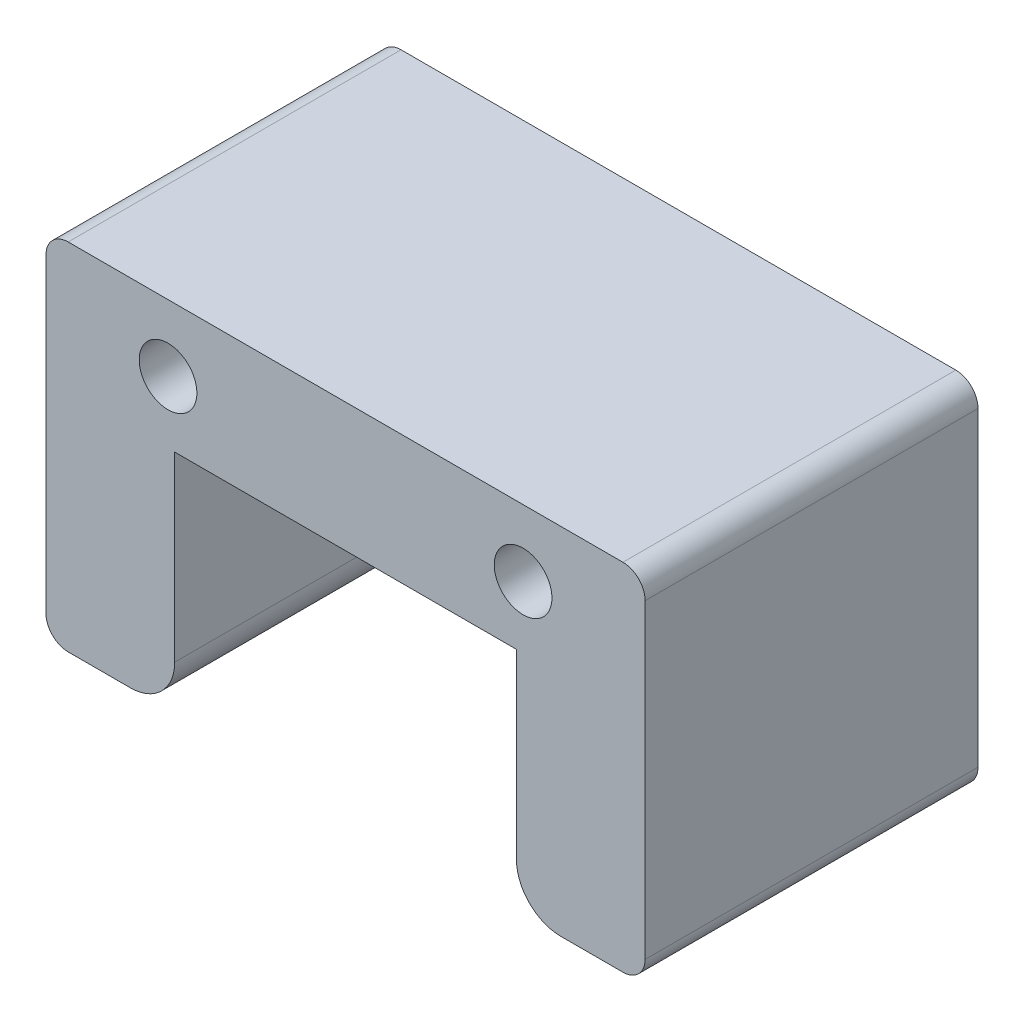
from build123d import *

# Parameters (mm, degrees)
SKETCH_1_R               = 1.3
EXTRUDE_1_DEPTH          = 15
FILLET_1_R               = 1
CUT_EXTRUDE_2_DEPTH      = 23.983689869
CUT_EXTRUDE_2_DEPTH_BACK = 23.983689869
FILLET_2_R               = 2
SKETCH_5_R               = 3.15
CUT_EXTRUDE_3_DEPTH      = 2.8


with BuildPart() as part:
    # ｽｹｯﾁ1 → ﾎﾞｽ - 押し出し1 (new body)
    with BuildSketch(Plane.XY):
        Polygon((-7.5, -5), (-7.5, 5), (7.5, 5), (7.5, -5), (13.5, -5), (13.5, 11), (-13.5, 11), (-13.5, -5), align=None)
        with Locations((-8, 8)):
            Circle(SKETCH_1_R, mode=Mode.SUBTRACT)
        with Locations((8, 8)):
            Circle(SKETCH_1_R, mode=Mode.SUBTRACT)
    extrude(amount=EXTRUDE_1_DEPTH)

    # ﾌｨﾚｯﾄ1
    fillet_1_edges = [part.edges().sort_by_distance(p)[0] for p in [
        (13.5, 11, 7.5),
        (-13.5, 11, 7.5),
        (13.5, -5, 7.5),
        (-13.5, -5, 7.5),
    ]]
    fillet(fillet_1_edges, radius=FILLET_1_R)

    # ｽｹｯﾁ3 → ｶｯﾄ - 押し出し2 (cut, two sides: drawn at the far end of the back side and taken through both)
    with BuildSketch(Plane.XY.offset(15).offset(-CUT_EXTRUDE_2_DEPTH_BACK)):
        Polygon((7.7, -68.120240963), (7.7, -5), (7.7, 5.2), (-7.7, 5.2), (-7.7, -5), (-7.7, -68.120240963), (-7.7, -194.36072289), (7.7, -194.36072289), align=None)
    extrude(amount=CUT_EXTRUDE_2_DEPTH + CUT_EXTRUDE_2_DEPTH_BACK, mode=Mode.SUBTRACT)

    # ﾌｨﾚｯﾄ2
    fillet_2_edges = [part.edges().sort_by_distance(p)[0] for p in [
        (7.7, -5, 7.5),
        (-7.7, -5, 7.5),
    ]]
    fillet(fillet_2_edges, radius=FILLET_2_R)

    # ｽｹｯﾁ5 → ｶｯﾄ - 押し出し3 (cut)
    with BuildSketch(Plane(origin=(0, 6, 0), x_dir=(-1, 0, 0), z_dir=(0, -1, 0))):
        with Locations((0, -7.5)):
            Circle(SKETCH_5_R)
    extrude(amount=-CUT_EXTRUDE_3_DEPTH, mode=Mode.SUBTRACT)


solid = part.part
